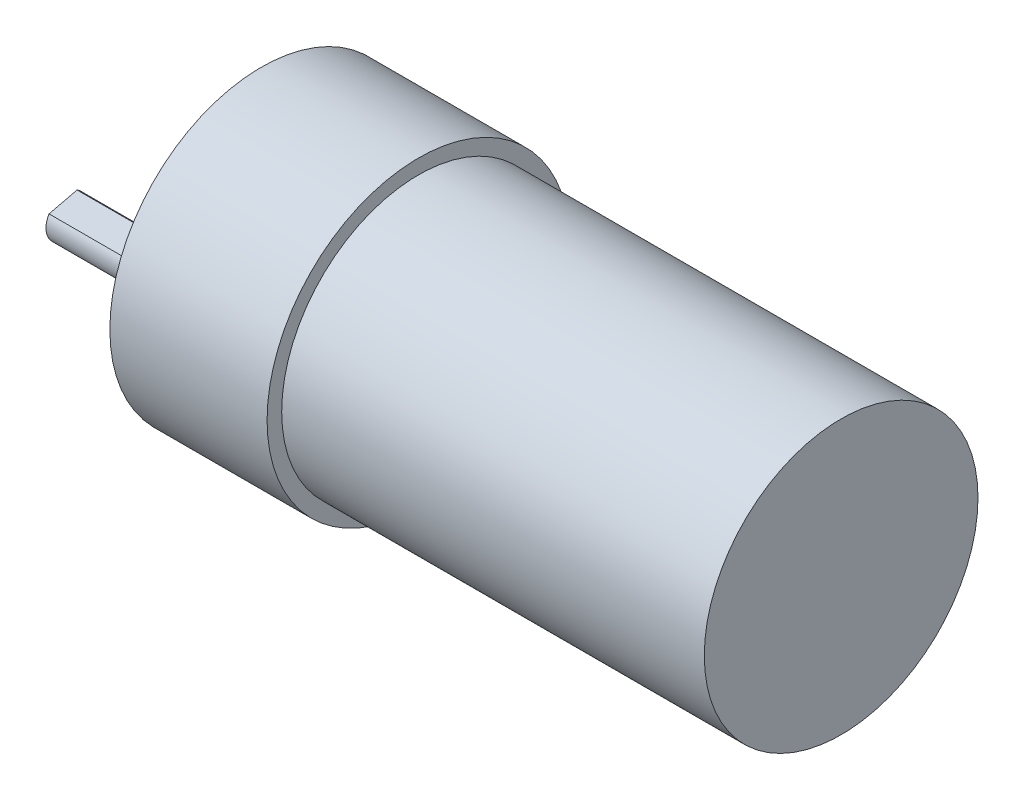
from build123d import *

# Parameters (mm, degrees)
SKETCH1_R          = 15.875
EXTRUDE1_DEPTH     = 49.022
SKETCH3_R          = 17.56918
EXTRUDE3_DEPTH     = 18.2372
SKETCH4_R          = 2.3749
EXTRUDE4_DEPTH     = 22.606
SKETCH5_R          = 1.27
CUT_EXTRUDE1_DEPTH = 10
SKETCH6_R          = 1.27
CUT_EXTRUDE2_DEPTH = 10
SKETCH7_W          = 17.727088037
SKETCH7_H          = 11.013879898
CUT_EXTRUDE3_DEPTH = 0.6858


with BuildPart() as part:
    # Sketch1 → Extrude1 (new body)
    with BuildSketch(Plane(origin=(0, 0, 0), x_dir=(0, 0, -1), z_dir=(1, 0, 0))):
        Circle(SKETCH1_R)
    extrude(amount=EXTRUDE1_DEPTH)

    # Sketch3 → Extrude3 (add)
    with BuildSketch(Plane.ZY):
        Circle(SKETCH3_R)
    extrude(amount=EXTRUDE3_DEPTH)

    # Sketch4 → Extrude4 (add)
    with BuildSketch(Plane.ZY.offset(18.2372)):
        with Locations((0, -8.71855)):
            Circle(SKETCH4_R)
    extrude(amount=EXTRUDE4_DEPTH)

    # Sketch5 → Cut-Extrude1 (cut)
    with BuildSketch(Plane.ZY.offset(18.2372)):
        with Locations((0, 13.45565)):
            Circle(SKETCH5_R)
    extrude(amount=-CUT_EXTRUDE1_DEPTH, mode=Mode.SUBTRACT)

    # Sketch6 → Cut-Extrude2 (cut)
    with BuildSketch(Plane.ZY.offset(18.2372)):
        with Locations((10.2108, -8.71855)):
            Circle(SKETCH6_R)
        with Locations((-10.2108, -8.71855)):
            Circle(SKETCH6_R)
    extrude(amount=-CUT_EXTRUDE2_DEPTH, mode=Mode.SUBTRACT)

    # Sketch7 → Cut-Extrude3 (cut)
    with BuildSketch(Plane(origin=(0, -5.937135101, -1.41983909), x_dir=(-1, 0, 0), z_dir=(0, 0.9725755792457034, 0.2325870646766169))):
        with Locations((34.720744018, 1.438658771)):
            Rectangle(SKETCH7_W, SKETCH7_H)
    extrude(amount=-CUT_EXTRUDE3_DEPTH, mode=Mode.SUBTRACT)


solid = part.part
